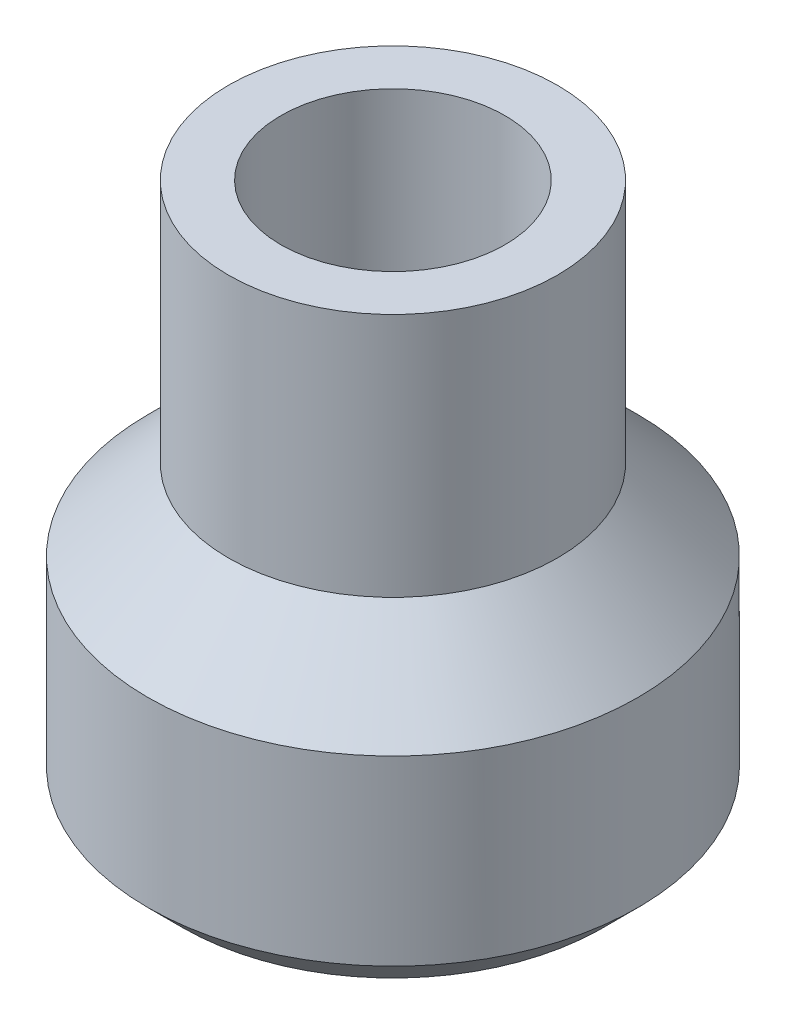
from build123d import *

# Parameters (mm, degrees)
SKETCH1_R           = 4.7
SKETCH1_R_2         = 3.2
BOSS_EXTRUDE1_DEPTH = 10
SKETCH2_R           = 7
BOSS_EXTRUDE2_DEPTH = 6
SKETCH3_R           = 6
CUT_EXTRUDE1_DEPTH  = 4
SKETCH4_R           = 3.2
CUT_EXTRUDE2_DEPTH  = 15.071247279
CHAMFER2_SIZE       = 1.5
CHAMFER4_SIZE       = 3
CHAMFER5_SIZE       = 1


with BuildPart() as part:
    # Sketch1 → Boss-Extrude1 (new body)
    with BuildSketch(Plane(origin=(0, 0, 0), x_dir=(1, 0, 0), z_dir=(0, 1, 0))):
        with Locations(Location((0, 0, 0), (0, 0, 270))):
            Circle(SKETCH1_R)
        with Locations(Location((0, 0, 0), (0, 0, 270))):
            Circle(SKETCH1_R_2, mode=Mode.SUBTRACT)
    extrude(amount=BOSS_EXTRUDE1_DEPTH)

    # Sketch2 → Boss-Extrude2 (add)
    with BuildSketch(Plane(origin=(0, 0, 0), x_dir=(1, 0, 0), z_dir=(0, 1, 0))):
        with Locations(Location((0, 0, 0), (0, 0, 270))):
            Circle(SKETCH2_R)
    extrude(amount=-BOSS_EXTRUDE2_DEPTH)

    # Sketch3 → Cut-Extrude1 (cut)
    with BuildSketch(Plane.XZ.offset(6)):
        with Locations(Location((0, 0, 0), (0, 0, 270))):
            Circle(SKETCH3_R)
    extrude(amount=-CUT_EXTRUDE1_DEPTH, mode=Mode.SUBTRACT)

    # Sketch4 → Cut-Extrude2 (cut, through all)
    with BuildSketch(Plane(origin=(0, 0, 0), x_dir=(1, 0, 0), z_dir=(0, 1, 0))):
        with Locations(Location((0, 0, 0), (0, 0, 270))):
            Circle(SKETCH4_R)
    extrude(amount=-CUT_EXTRUDE2_DEPTH, mode=Mode.SUBTRACT)

    # Chamfer2
    # the kernel refuses this chamfer: 1.5 mm, written as the material it takes off along each edge
    with BuildSketch(Plane(origin=(0, -6, 0), x_dir=(0, 0, 1), z_dir=(-1, 0, 0))) as chamfer2_piece_1:
        Polygon((7, CHAMFER2_SIZE), (7 - CHAMFER2_SIZE, 0), (7, 0), align=None)
    revolve(axis=Axis((0, -6, 0), (0, 1, 0)), mode=Mode.SUBTRACT)

    # Chamfer4
    # the kernel refuses this chamfer: 3 mm, written as the material it adds along each edge
    with BuildSketch(Plane(origin=(0, 0, 0), x_dir=(0, 0, 1), z_dir=(-1, 0, 0))) as chamfer4_piece_1_section:
        Polygon((4.7 + CHAMFER4_SIZE, 0), (4.7, CHAMFER4_SIZE), (4.7, 0), align=None)
    chamfer4_piece_1 = revolve(axis=Axis((0, 0, 0), (0, 1, 0)), mode=Mode.PRIVATE)
    chamfer4_piece_1 = chamfer4_piece_1 & Plane(origin=(0, 1.853894362, 0), x_dir=(0, 0, 1), z_dir=(0, 1, 0)) * Cylinder(7, 31, mode=Mode.PRIVATE)
    add(chamfer4_piece_1)

    # Chamfer5
    chamfer5_edges = [part.edges().sort_by_distance(p)[0] for p in [
        (0, -2, -3.2),
    ]]
    chamfer(chamfer5_edges, length=CHAMFER5_SIZE)


solid = part.part
